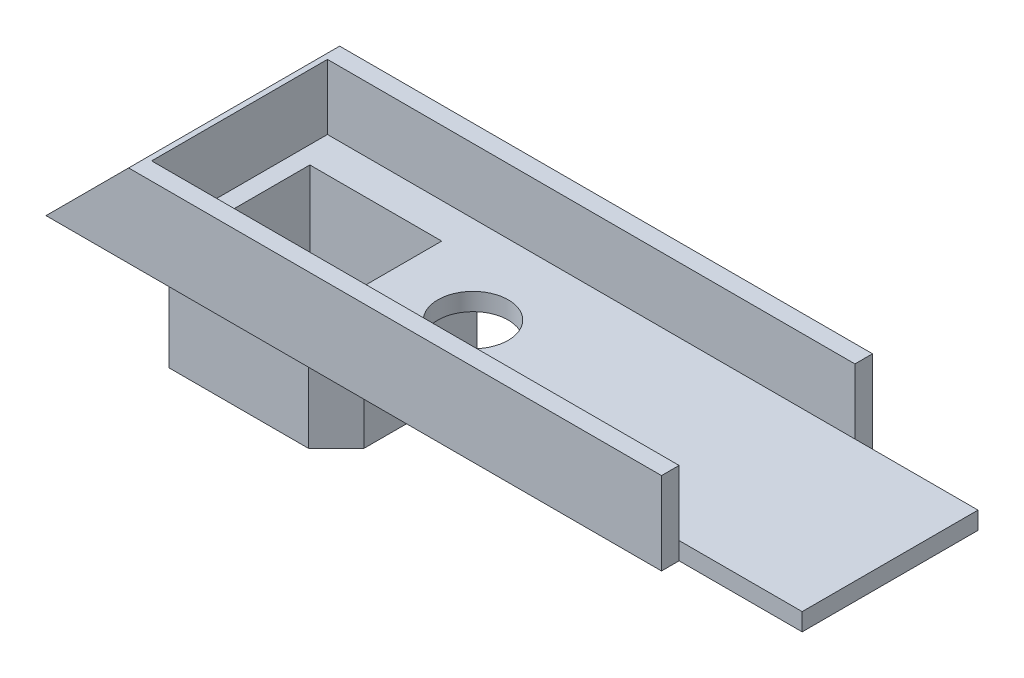
from build123d import *

# Parameters (mm, degrees)
EXTRUDE_1_DEPTH     = 1
EXTRUDE_2_DEPTH     = 6
SKETCH_3_R          = 2
CUT_EXTRUDE_1_DEPTH = 1
EXTRUDE_3_DEPTH     = 3.7
EXTRUDE_4_DEPTH     = 12
CUT_EXTRUDE_2_DEPTH = 12


with BuildPart() as part:
    # 草图1 → 凸台-拉伸1 (new body)
    with BuildSketch(Plane(origin=(0, 0, 0), x_dir=(1, 0, 0), z_dir=(0, 1, 0))):
        Polygon((23.47582205, -4.484524381), (23.47582205, -14.484524381), (16.47582205, -14.484524381), (16.47582205, -15.484524381), (2.97582205, -15.484524381), (-4.02417795, -15.484524381), (-14.52417795, -15.484524381), (-14.52417795, -3.484524381), (-4.02417795, -3.484524381), (2.97582205, -3.484524381), (16.47582205, -3.484524381), (16.47582205, -4.484524381), align=None)
        Polygon((-12.52417795, -6.484524381), (-12.52417795, -12.484524381), (-6.02417795, -12.484524381), (-5.02417795, -11.484524381), (-5.02417795, -6.484524381), align=None, mode=Mode.SUBTRACT)
    extrude(amount=EXTRUDE_1_DEPTH)

    # 草图2 → 凸台-拉伸2 (add)
    with BuildSketch(Plane.XZ):
        Polygon((-13.52417795, 5.484524381), (-13.52417795, 13.484524381), (-5.609964387, 13.484524381), (-4.02417795, 11.898737944), (-4.02417795, 5.484524381), align=None)
        Polygon((-12.52417795, 12.484524381), (-6.02417795, 12.484524381), (-5.02417795, 11.484524381), (-5.02417795, 6.484524381), (-12.52417795, 6.484524381), align=None, mode=Mode.SUBTRACT)
    extrude(amount=EXTRUDE_2_DEPTH)

    # 草图3 → 切除-拉伸1 (cut)
    with BuildSketch(Plane(origin=(0, 1, 0), x_dir=(1, 0, 0), z_dir=(0, 1, 0))):
        with Locations((-0.24417795, -9.484524381)):
            Circle(SKETCH_3_R)
    extrude(amount=-CUT_EXTRUDE_1_DEPTH, mode=Mode.SUBTRACT)

    # 草图4 → 凸台-拉伸3 (add)
    with BuildSketch(Plane(origin=(0, 1, 0), x_dir=(1, 0, 0), z_dir=(0, 1, 0))):
        Polygon((-14.52417795, -3.484524381), (16.47582205, -3.484524381), (16.47582205, -4.484524381), (-13.52417795, -4.484524381), (-13.52417795, -14.484524381), (16.47582205, -14.484524381), (16.47582205, -15.484524381), (-14.52417795, -15.484524381), align=None)
    extrude(amount=EXTRUDE_3_DEPTH)

    # 草图7 → 凸台-拉伸4 (add)
    with BuildSketch(Plane.XY.offset(15.484524381)):
        Polygon((-14.52417795, 0), (-14.52417795, 4.7), (-19.22417795, 0), align=None)
    extrude(amount=-EXTRUDE_4_DEPTH)

    # 草图8 → 切除-拉伸2 (cut)
    with BuildSketch(Plane.XY.offset(15.484524381)):
        Polygon((-14.52417795, 4.7), (-19.22417795, 0), (-18.531213304, 0), (-13.831213304, 4.7), align=None)
    extrude(amount=-CUT_EXTRUDE_2_DEPTH, mode=Mode.SUBTRACT)


solid = part.part
